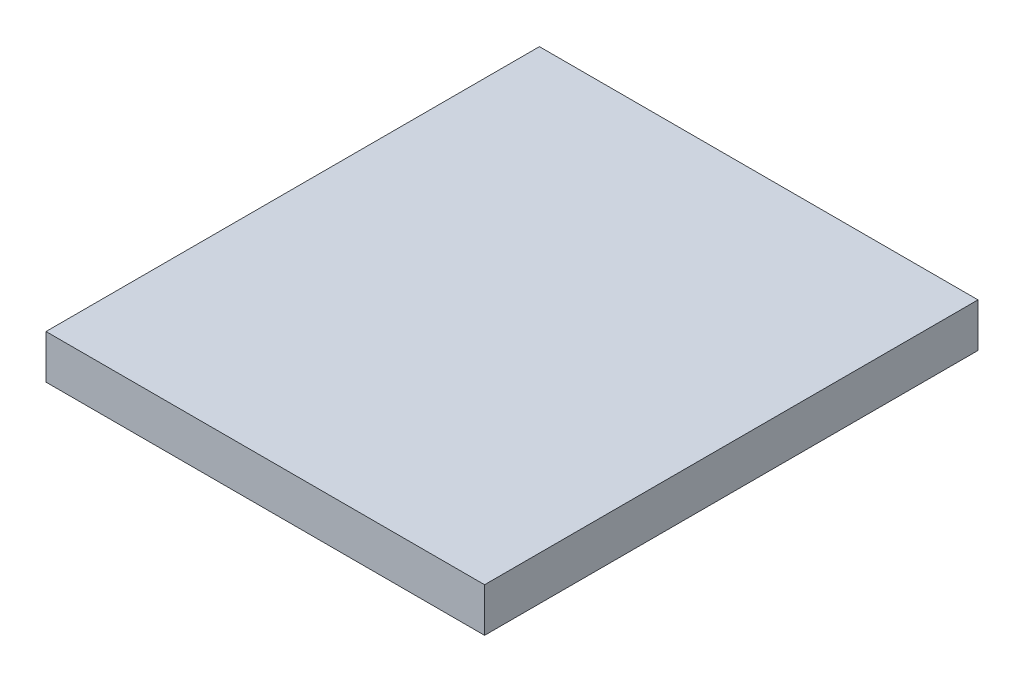
from build123d import *

# Parameters (mm, degrees)
SKETCH1_W           = 40
SKETCH1_H           = 45
BOSS_EXTRUDE1_DEPTH = 4


with BuildPart() as part:
    # Sketch1 → Boss-Extrude1 (new body)
    with BuildSketch(Plane(origin=(0, 0, 0), x_dir=(1, 0, 0), z_dir=(0, 1, 0))):
        with Locations((20, 22.5)):
            Rectangle(SKETCH1_W, SKETCH1_H)
    extrude(amount=BOSS_EXTRUDE1_DEPTH)


solid = part.part
